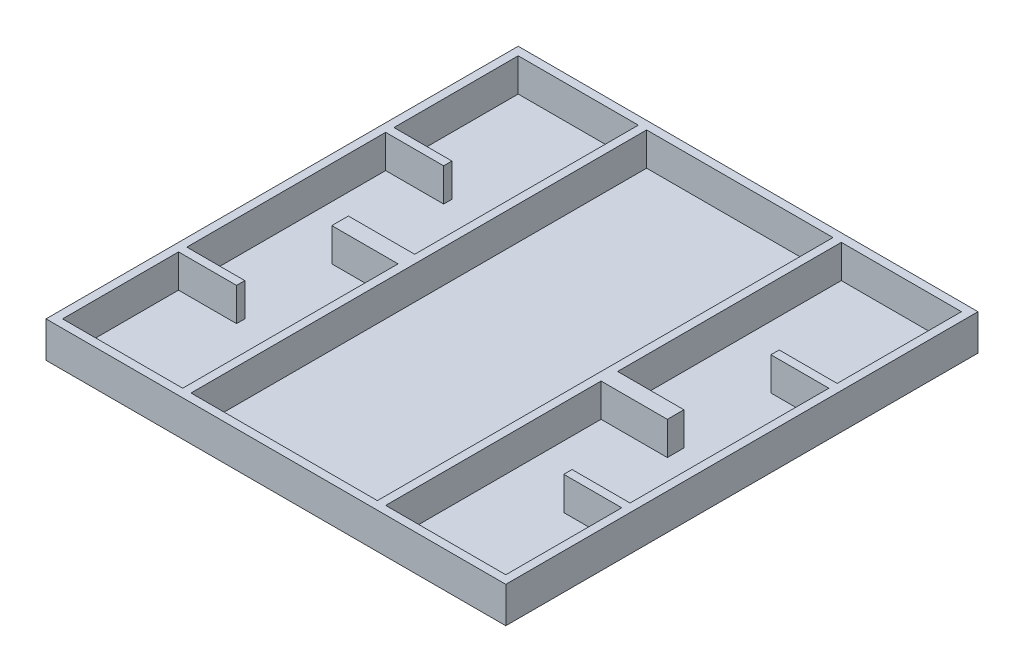
from build123d import *

# Parameters (mm, degrees)
EXTRUDE_THIN1_OUTLINE_W   = 4229.1
EXTRUDE_THIN1_OUTLINE_H   = 4343.4
EXTRUDE_THIN1_OUTLINE_W_2 = 1104.9
EXTRUDE_THIN1_OUTLINE_H_2 = 4191
EXTRUDE_THIN1_OUTLINE_W_3 = 1714.5
EXTRUDE_THIN1_DEPTH       = 304.8
SKETCH2_W                 = 4229.1
SKETCH2_H                 = 4343.4
BOSS_EXTRUDE2_DEPTH       = 25.4
SKETCH3_W                 = 533.4
SKETCH3_H                 = 76.2
SKETCH3_W_2               = 609.6
SKETCH3_H_2               = 152.4
BOSS_EXTRUDE3_DEPTH       = 304.8


# Read off the part's stored shape, not the designer's step: Extrude-Thin1
with BuildPart() as part:
    # Extrude-Thin1 outline → Extrude-Thin1 (new body)
    with BuildSketch(Plane(origin=(0, 0, 0), x_dir=(1, 0, 0), z_dir=(0, 1, 0))):
        with Locations((1485.9, 0)):
            Rectangle(EXTRUDE_THIN1_OUTLINE_W, EXTRUDE_THIN1_OUTLINE_H)
        Rectangle(EXTRUDE_THIN1_OUTLINE_W_2, EXTRUDE_THIN1_OUTLINE_H_2, mode=Mode.SUBTRACT)
        with Locations((1485.9, 0)):
            Rectangle(EXTRUDE_THIN1_OUTLINE_W_3, EXTRUDE_THIN1_OUTLINE_H_2, mode=Mode.SUBTRACT)
        with Locations((2971.8, 0)):
            Rectangle(EXTRUDE_THIN1_OUTLINE_W_2, EXTRUDE_THIN1_OUTLINE_H_2, mode=Mode.SUBTRACT)
    extrude(amount=EXTRUDE_THIN1_DEPTH)

    # Sketch2 → Boss-Extrude2 (add)
    with BuildSketch(Plane.XZ):
        with Locations((1485.9, 0)):
            Rectangle(SKETCH2_W, SKETCH2_H)
    extrude(amount=BOSS_EXTRUDE2_DEPTH)

    # Sketch3 → Boss-Extrude3 (add)
    with BuildSketch(Plane(origin=(0, 0, 0), x_dir=(1, 0, 0), z_dir=(0, 1, 0))):
        with Locations((-285.75, -990.6)):
            Rectangle(SKETCH3_W, SKETCH3_H)
        with Locations((-285.75, 914.4)):
            Rectangle(SKETCH3_W, SKETCH3_H)
        with Locations((247.65, -38.1)):
            Rectangle(SKETCH3_W_2, SKETCH3_H_2)
    boss_extrude3 = extrude(amount=BOSS_EXTRUDE3_DEPTH)

    # Mirror1: Boss-Extrude3 across plane
    add(boss_extrude3.mirror(Plane.ZY.offset(-1485.9)))


solid = part.part
